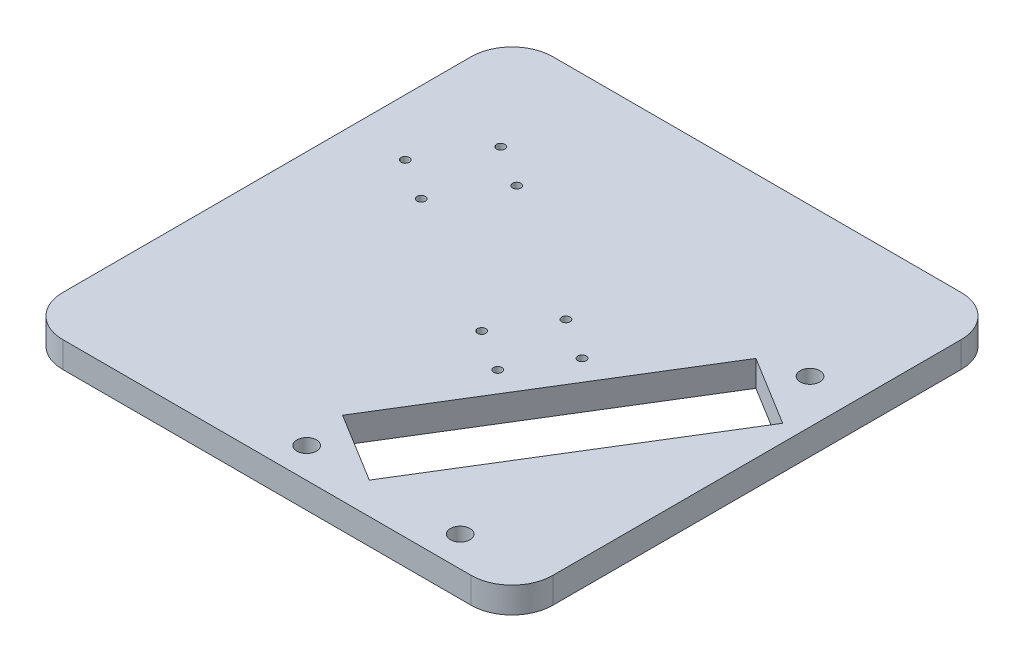
from build123d import *

# Parameters (mm, degrees)
BOSS_EXTRUDE1_DEPTH = 6.35
SKETCH2_R           = 2.4
CUT_EXTRUDE1_DEPTH  = 170.824387236
SKETCH5_R           = 1.025
CUT_EXTRUDE2_DEPTH  = 170.824387236


with BuildPart() as part:
    # Sketch1 → Boss-Extrude1 (new body)
    with BuildSketch(Plane(origin=(0, 0, 0), x_dir=(1, 0, 0), z_dir=(0, 1, 0))):
        with BuildLine():
            Line((10, 0), (110, 0))
            ThreePointArc((110, 0), (117.071067812, 2.928932188), (120, 10))
            Line((120, 10), (120, 110))
            ThreePointArc((120, 110), (117.071067812, 117.071067812), (110, 120))
            Line((110, 120), (10, 120))
            ThreePointArc((10, 120), (2.928932188, 117.071067812), (0, 110))
            Line((0, 110), (0, 10))
            ThreePointArc((0, 10), (2.928932188, 2.928932188), (10, 0))
        make_face()
    extrude(amount=BOSS_EXTRUDE1_DEPTH)

    # Sketch2 → Cut-Extrude1 (cut, through all)
    with BuildSketch(Plane(origin=(0, 6.35, 0), x_dir=(1, 0, 0), z_dir=(0, 1, 0))):
        with Locations((62.326447526, 7.4)):
            Circle(SKETCH2_R)
        with Locations((99.90831454, 7.4)):
            Circle(SKETCH2_R)
        with Locations((109.276743553, 83.69973137)):
            Circle(SKETCH2_R)
        Polygon((60.291464341, 18.213164461), (77.324967949, 7.731764037), (115.886040109, 70.398023809), (98.852536501, 80.879424234), align=None)
    extrude(amount=-CUT_EXTRUDE1_DEPTH, mode=Mode.SUBTRACT)

    # Sketch5 → Cut-Extrude2 (cut, through all)
    with BuildSketch(Plane(origin=(0, 6.35, 0), x_dir=(1, 0, 0), z_dir=(0, 1, 0))):
        with Locations((69.679748999, 46.827220643)):
            Circle(SKETCH5_R)
        with Locations((59.459646835, 53.116060898)):
            Circle(SKETCH5_R)
        with Locations((77.540799318, 59.602348349)):
            Circle(SKETCH5_R)
        with Locations((67.320697153, 65.891188603)):
            Circle(SKETCH5_R)
        with Locations((13.796792254, 80.040096841)):
            Circle(SKETCH5_R)
        with Locations((24.016894418, 73.751256587)):
            Circle(SKETCH5_R)
        with Locations((32.926084779, 88.229734653)):
            Circle(SKETCH5_R)
        with Locations((22.705982614, 94.518574908)):
            Circle(SKETCH5_R)
    extrude(amount=-CUT_EXTRUDE2_DEPTH, mode=Mode.SUBTRACT)


solid = part.part
